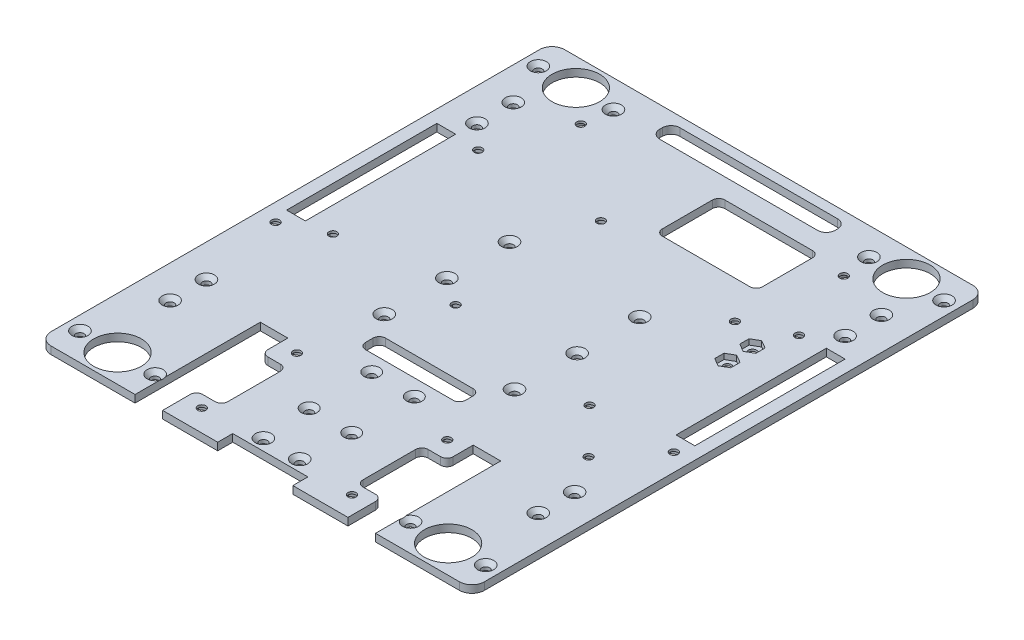
from build123d import *

# Parameters (mm, degrees)
SKETCH1_W           = 173
SKETCH1_H           = 205
BOSS_EXTRUDE1_DEPTH = 3
SKETCH2_R           = 9.5
CUT_EXTRUDE1_DEPTH  = 3
HOLE3_AT_2_COUNT    = 2
HOLE3_AT_2_PITCH    = 30
HOLE3_AT_3_COUNT    = 2
HOLE3_AT_3_PITCH    = 102
HOLE3_AT_4_COUNT    = 2
HOLE3_AT_4_PITCH    = 132
HOLE3_AT_5_COUNT    = 2
HOLE3_AT_5_PITCH    = 225.639092358
HOLE3_AT_6_COUNT    = 2
HOLE3_AT_6_PITCH    = 209.506563143
HOLE3_AT_7_COUNT    = 2
HOLE3_AT_7_PITCH    = 183
HOLE3_AT_8_COUNT    = 2
HOLE3_AT_8_PITCH    = 185.442713526
HOLE1_AT_2_COUNT    = 2
HOLE1_AT_2_PITCH    = 52
HOLE1_AT_3_COUNT    = 2
HOLE1_AT_3_PITCH    = 57.697486947
HOLE1_AT_4_COUNT    = 2
HOLE1_AT_4_PITCH    = 25
HOLE1_AT_5_COUNT    = 2
HOLE1_AT_5_PITCH    = 50
HOLE1_AT_6_COUNT    = 2
HOLE1_AT_6_PITCH    = 72.138755187
SKETCH6_R           = 1.6
CUT_EXTRUDE2_DEPTH  = 2.1
SKETCH6_2_R         = 1.6
SKETCH6_2_W         = 10
SKETCH6_2_H         = 26
CUT_EXTRUDE3_DEPTH  = 269.259203011
HOLE2_AT_2_COUNT    = 2
HOLE2_AT_2_PITCH    = 25
HOLE2_AT_3_COUNT    = 2
HOLE2_AT_3_PITCH    = 30.232432916
HOLE2_AT_4_COUNT    = 2
HOLE2_AT_4_PITCH    = 17
SKETCH20_W          = 20
SKETCH20_H          = 8
CUT_EXTRUDE17_DEPTH = 269.259203011
CUT_EXTRUDE7_DEPTH  = 2.1
HOLE4_D             = 3.2
SKETCH13_4_W        = 40
SKETCH13_4_H        = 25
CUT_EXTRUDE18_DEPTH = 269.259203011
SKETCH19_R          = 1.6
CUT_EXTRUDE15_DEPTH = 2.1
SKETCH19_2_R        = 1.6
CUT_EXTRUDE16_DEPTH = 269.259203011
SKETCH21_W          = 7.5
SKETCH21_H          = 25
CUT_EXTRUDE19_DEPTH = 269.259203011
SKETCH22_3_R        = 1.6
CUT_EXTRUDE21_DEPTH = 269.259203011
SKETCH22_R          = 1.6
CUT_EXTRUDE20_DEPTH = 2.1
HOLE5_AT_2_COUNT    = 2
HOLE5_AT_2_PITCH    = 14.5
HOLE5_AT_3_COUNT    = 2
HOLE5_AT_3_PITCH    = 147.713404943
HOLE5_AT_4_COUNT    = 2
HOLE5_AT_4_PITCH    = 147
HOLE5_AT_5_COUNT    = 2
HOLE5_AT_5_PITCH    = 191.35111706
HOLE5_AT_6_COUNT    = 2
HOLE5_AT_6_PITCH    = 200.942777924
HOLE5_AT_7_COUNT    = 2
HOLE5_AT_7_PITCH    = 137
HOLE5_AT_8_COUNT    = 2
HOLE5_AT_8_PITCH    = 122.5
SKETCH30_W          = 30
SKETCH30_H          = 6
CUT_EXTRUDE27_DEPTH = 269.259203011
HOLE6_AT_2_COUNT    = 2
HOLE6_AT_2_PITCH    = 14.5
SKETCH29_W          = 70
SKETCH29_H          = 8
CUT_EXTRUDE26_DEPTH = 269.259203011
SKETCH33_R          = 1.6
CUT_EXTRUDE28_DEPTH = 2.2
SKETCH33_3_R        = 1.6
CUT_EXTRUDE29_DEPTH = 269.259203011
FILLET1_R           = 5
FILLET2_R           = 2.5
FILLET3_R           = 3.5


with BuildPart() as part:
    # Sketch1 → Boss-Extrude1 (new body)
    with BuildSketch(Plane(origin=(0, 0, 0), x_dir=(1, 0, 0), z_dir=(0, 1, 0))):
        with Locations((-86.5, 102.5)):
            Rectangle(SKETCH1_W, SKETCH1_H)
    extrude(amount=BOSS_EXTRUDE1_DEPTH)

    # Sketch2 → Cut-Extrude1 (cut)
    with BuildSketch(Plane(origin=(0, 3, 0), x_dir=(1, 0, 0), z_dir=(0, 1, 0))):
        with Locations(Location((-152.5, 194, 0), (0, 0, 270))):
            Circle(SKETCH2_R)
        with Locations(Location((-20.5, 194, 0), (0, 0, 270))):
            Circle(SKETCH2_R)
        with Locations(Location((-20.5, 11, 0), (0, 0, 270))):
            Circle(SKETCH2_R)
        with Locations(Location((-152.5, 11, 0), (0, 0, 270))):
            Circle(SKETCH2_R)
    extrude(amount=-CUT_EXTRUDE1_DEPTH, mode=Mode.SUBTRACT)

    # Sketch17 → Hole3 (revolve, cut)
    with BuildSketch(Plane(origin=(-137.5, 3, -11), x_dir=(0, 0, 1), z_dir=(1, 0, 0))):
        Polygon((0, 0), (0, 3), (1.6, 3), (1.6, 1.746093602), (3.2, 0), align=None)
    hole3 = revolve(axis=Axis((-137.5, 9.445314094, -11), (0, -1, 0)), mode=Mode.SUBTRACT)

    # Hole3 at 2: Hole3 ×2
    with Locations(*[(-i * HOLE3_AT_2_PITCH, 0, 0) for i in range(1, HOLE3_AT_2_COUNT)]):
        add(hole3, mode=Mode.SUBTRACT)

    # Hole3 at 3: Hole3 ×2
    with Locations(*[(i * HOLE3_AT_3_PITCH, 0, 0) for i in range(1, HOLE3_AT_3_COUNT)]):
        add(hole3, mode=Mode.SUBTRACT)

    # Hole3 at 4: Hole3 ×2
    with Locations(*[(i * HOLE3_AT_4_PITCH, 0, 0) for i in range(1, HOLE3_AT_4_COUNT)]):
        add(hole3, mode=Mode.SUBTRACT)

    # Hole3 at 5: Hole3 ×2
    with Locations(*[Vector(0.5850050122996966, 0, -0.811029676142761) * (i * HOLE3_AT_5_PITCH) for i in range(1, HOLE3_AT_5_COUNT)]):
        add(hole3, mode=Mode.SUBTRACT)

    # Hole3 at 6: Hole3 ×2
    with Locations(*[Vector(0.48685825622737094, 0, -0.8734809891138121) * (i * HOLE3_AT_6_PITCH) for i in range(1, HOLE3_AT_6_COUNT)]):
        add(hole3, mode=Mode.SUBTRACT)

    # Hole3 at 7: Hole3 ×2
    with Locations(*[(0, 0, -i * HOLE3_AT_7_PITCH) for i in range(1, HOLE3_AT_7_COUNT)]):
        add(hole3, mode=Mode.SUBTRACT)

    # Hole3 at 8: Hole3 ×2
    with Locations(*[Vector(-0.1617750270664808, 0, -0.9868276651055338) * (i * HOLE3_AT_8_PITCH) for i in range(1, HOLE3_AT_8_COUNT)]):
        add(hole3, mode=Mode.SUBTRACT)

    # Sketch4 → Hole1 (revolve, cut)
    with BuildSketch(Plane(origin=(-112.5, 3, -127.5), x_dir=(0, 0, 1), z_dir=(1, 0, 0))):
        Polygon((0, 0), (0, 3), (1.6, 3), (1.6, 1.746093602), (3.2, 0), align=None)
    hole1 = revolve(axis=Axis((-112.5, 9.445314094, -127.5), (0, -1, 0)), mode=Mode.SUBTRACT)

    # Hole1 at 2: Hole1 ×2
    with Locations(*[(i * HOLE1_AT_2_PITCH, 0, 0) for i in range(1, HOLE1_AT_2_COUNT)]):
        add(hole1, mode=Mode.SUBTRACT)

    # Hole1 at 3: Hole1 ×2
    with Locations(*[Vector(0.9012524245251863, 0, 0.43329443486787755) * (i * HOLE1_AT_3_PITCH) for i in range(1, HOLE1_AT_3_COUNT)]):
        add(hole1, mode=Mode.SUBTRACT)

    # Hole1 at 4: Hole1 ×2
    with Locations(*[(0, 0, i * HOLE1_AT_4_PITCH) for i in range(1, HOLE1_AT_4_COUNT)]):
        add(hole1, mode=Mode.SUBTRACT)

    # Hole1 at 5: Hole1 ×2
    with Locations(*[(0, 0, i * HOLE1_AT_5_PITCH) for i in range(1, HOLE1_AT_5_COUNT)]):
        add(hole1, mode=Mode.SUBTRACT)

    # Hole1 at 6: Hole1 ×2
    with Locations(*[Vector(0.7208330649018581, 0, 0.6931087162517825) * (i * HOLE1_AT_6_PITCH) for i in range(1, HOLE1_AT_6_COUNT)]):
        add(hole1, mode=Mode.SUBTRACT)

    # Sketch6 → Cut-Extrude2 (cut)
    # profile 1 of 4: a face of its own
    with BuildSketch(Plane.XZ):
        Polygon((-59.65, -6.818653348), (-59.65, -10.455960044), (-56.5, -12.274613392), (-53.35, -10.455960044), (-53.35, -6.818653348), (-56.5, -5), align=None)
        with Locations(Location((-56.5, -8.637306696, 0), (0, 0, 270))):
            Circle(SKETCH6_R, mode=Mode.SUBTRACT)
    # profile 2 of 4: a face of its own
    with BuildSketch(Plane.XZ):
        Polygon((-59.65, -48.455960044), (-56.5, -50.274613392), (-53.35, -48.455960044), (-53.35, -44.818653348), (-56.5, -43), (-59.65, -44.818653348), align=None)
        with Locations(Location((-56.5, -46.637306696, 0), (0, 0, 270))):
            Circle(SKETCH6_R, mode=Mode.SUBTRACT)
    # profile 3 of 4: a face of its own
    with BuildSketch(Plane.XZ):
        Polygon((-116.5, -12.274613392), (-119.65, -10.455960044), (-119.65, -6.818653348), (-116.5, -5), (-113.35, -6.818653348), (-113.35, -10.455960044), align=None)
        with Locations(Location((-116.5, -8.637306696, 0), (0, 0, 270))):
            Circle(SKETCH6_R, mode=Mode.SUBTRACT)
    # profile 4 of 4: a face of its own
    with BuildSketch(Plane.XZ):
        Polygon((-116.5, -43), (-113.35, -44.818653348), (-113.35, -48.455960044), (-116.5, -50.274613392), (-119.65, -48.455960044), (-119.65, -44.818653348), align=None)
        with Locations(Location((-116.5, -46.637306696, 0), (0, 0, 270))):
            Circle(SKETCH6_R, mode=Mode.SUBTRACT)
    extrude(amount=-CUT_EXTRUDE2_DEPTH, mode=Mode.SUBTRACT)

    # Sketch6<2> → Cut-Extrude3 (cut, through all)
    with BuildSketch(Plane.XZ):
        Polygon((-123.5, -13.5), (-123.5, 0), (-134.5, 0), (-134.5, -50), (-123.5, -50), (-123.5, -39.5), align=None)
        Polygon((-38.5, 0), (-49.5, 0), (-49.5, -13.5), (-49.5, -39.5), (-49.5, -50), (-38.5, -50), align=None)
        with Locations(Location((-116.5, -8.637306696, 0), (0, 0, 270))):
            Circle(SKETCH6_2_R)
        with Locations(Location((-116.5, -46.637306696, 0), (0, 0, 270))):
            Circle(SKETCH6_2_R)
        with Locations(Location((-56.5, -46.637306696, 0), (0, 0, 270))):
            Circle(SKETCH6_2_R)
        with Locations(Location((-56.5, -8.637306696, 0), (0, 0, 270))):
            Circle(SKETCH6_2_R)
        with Locations((-118.5, -26.5)):
            Rectangle(SKETCH6_2_W, SKETCH6_2_H)
        with Locations((-54.5, -26.5)):
            Rectangle(SKETCH6_2_W, SKETCH6_2_H)
    extrude(amount=-CUT_EXTRUDE3_DEPTH, mode=Mode.SUBTRACT)

    # Sketch10 → Hole2 (revolve, cut)
    with BuildSketch(Plane(origin=(-95, 3, -55), x_dir=(0, 0, 1), z_dir=(1, 0, 0))):
        Polygon((0, 0), (0, 3), (1.6, 3), (1.6, 1.636962752), (3.1, 0), align=None)
    hole2 = revolve(axis=Axis((-95, 9.445314094, -55), (0, -1, 0)), mode=Mode.SUBTRACT)

    # Hole2 at 2: Hole2 ×2
    with Locations(*[(0, 0, i * HOLE2_AT_2_PITCH) for i in range(1, HOLE2_AT_2_COUNT)]):
        add(hole2, mode=Mode.SUBTRACT)

    # Hole2 at 3: Hole2 ×2
    with Locations(*[Vector(0.5623100214072783, 0, 0.8269265020695288) * (i * HOLE2_AT_3_PITCH) for i in range(1, HOLE2_AT_3_COUNT)]):
        add(hole2, mode=Mode.SUBTRACT)

    # Hole2 at 4: Hole2 ×2
    with Locations(*[(i * HOLE2_AT_4_PITCH, 0, 0) for i in range(1, HOLE2_AT_4_COUNT)]):
        add(hole2, mode=Mode.SUBTRACT)

    # Sketch20 → Cut-Extrude17 (cut, through all)
    with BuildSketch(Plane(origin=(0, 3, 0), x_dir=(1, 0, 0), z_dir=(0, 1, 0))):
        with Locations((-76.5, 65.5)):
            Rectangle(SKETCH20_W, SKETCH20_H)
        with Locations((-96.5, 65.5)):
            Rectangle(SKETCH20_W, SKETCH20_H)
    extrude(amount=-CUT_EXTRUDE17_DEPTH, mode=Mode.SUBTRACT)

    # Sketch13 → Cut-Extrude7 (cut)
    with BuildSketch(Plane.XZ):
        Polygon((-19.3, -70.789785834), (-19.3, -67.210214166), (-22.4, -65.420428331), (-25.5, -67.210214166), (-25.5, -70.789785834), (-22.4, -72.579571669), align=None)
        Polygon((-147.7, -93.383419246), (-150.5, -91.766838493), (-153.3, -93.383419246), (-153.3, -96.616580754), (-150.5, -98.233161507), (-147.7, -96.616580754), align=None)
        Polygon((-98.7, -96.616580754), (-98.7, -93.383419246), (-101.5, -91.766838493), (-104.3, -93.383419246), (-104.3, -96.616580754), (-101.5, -98.233161507), align=None)
        Polygon((-147.7, -154.616580754), (-147.7, -151.383419246), (-150.5, -149.766838493), (-153.3, -151.383419246), (-153.3, -154.616580754), (-150.5, -156.233161507), align=None)
        Polygon((-98.7, -151.383419246), (-101.5, -149.766838493), (-104.3, -151.383419246), (-104.3, -154.616580754), (-101.5, -156.233161507), (-98.7, -154.616580754), align=None)
        Polygon((-22.4, -149.420428331), (-25.5, -151.210214166), (-25.5, -154.789785834), (-22.4, -156.579571669), (-19.3, -154.789785834), (-19.3, -151.210214166), align=None)
    extrude(amount=-CUT_EXTRUDE7_DEPTH, mode=Mode.SUBTRACT)

    # Hole4 (through all)
    with Locations(Plane(origin=(-150.5, 0, -95), x_dir=(0, 0, -1), z_dir=(0, -1, 0))):
        with Locations((0, 0), (0, 49), (58, 49), (58, 0), (58, 128.1), (-26, 128.1)):
            Hole(HOLE4_D / 2)

    # Sketch13<4> → Cut-Extrude18 (cut, through all)
    with BuildSketch(Plane.XZ):
        with Locations((-66.5, -172.5)):
            Rectangle(SKETCH13_4_W, SKETCH13_4_H)
    extrude(amount=-CUT_EXTRUDE18_DEPTH, mode=Mode.SUBTRACT)

    # Sketch19 → Cut-Extrude15 (cut)
    # profile 1 of 4: a face of its own
    with BuildSketch(Plane(origin=(0, 0, 0), x_dir=(1, 0, 0), z_dir=(0, 1, 0))):
        Polygon((-135.304958277, 182.5), (-137.152479139, 185.7), (-140.847520861, 185.7), (-142.695041723, 182.5), (-140.847520861, 179.3), (-137.152479139, 179.3), align=None)
        with Locations(Location((-139, 182.5, 0), (0, 0, 270))):
            Circle(SKETCH19_R, mode=Mode.SUBTRACT)
    # profile 2 of 4: a face of its own
    with BuildSketch(Plane(origin=(0, 0, 0), x_dir=(1, 0, 0), z_dir=(0, 1, 0))):
        Polygon((-32.152479139, 179.3), (-30.304958277, 182.5), (-32.152479139, 185.7), (-35.847520861, 185.7), (-37.695041723, 182.5), (-35.847520861, 179.3), align=None)
        with Locations(Location((-34, 182.5, 0), (0, 0, 270))):
            Circle(SKETCH19_R, mode=Mode.SUBTRACT)
    # profile 3 of 4: a face of its own
    with BuildSketch(Plane(origin=(0, 0, 0), x_dir=(1, 0, 0), z_dir=(0, 1, 0))):
        Polygon((-166, 91.305041723), (-169.2, 89.457520861), (-169.2, 85.762479139), (-166, 83.914958277), (-162.8, 85.762479139), (-162.8, 89.457520861), align=None)
        with Locations(Location((-166, 87.61, 0), (0, 0, 270))):
            Circle(SKETCH19_R, mode=Mode.SUBTRACT)
    # profile 4 of 4: a face of its own
    with BuildSketch(Plane(origin=(0, 0, 0), x_dir=(1, 0, 0), z_dir=(0, 1, 0))):
        Polygon((-10.2, 89.457520861), (-7, 91.305041723), (-3.8, 89.457520861), (-3.8, 85.762479139), (-7, 83.914958277), (-10.2, 85.762479139), align=None)
        with Locations(Location((-7, 87.61, 0), (0, 0, 90))):
            Circle(SKETCH19_R, mode=Mode.SUBTRACT)
    extrude(amount=CUT_EXTRUDE15_DEPTH, mode=Mode.SUBTRACT)

    # Sketch19<2> → Cut-Extrude16 (cut, through all)
    with BuildSketch(Plane(origin=(0, 0, 0), x_dir=(1, 0, 0), z_dir=(0, 1, 0))):
        with Locations(Location((-34, 182.5, 0), (0, 0, 270))):
            Circle(SKETCH19_2_R)
        with Locations(Location((-139, 182.5, 0), (0, 0, 270))):
            Circle(SKETCH19_2_R)
        with Locations(Location((-166, 87.61, 0), (0, 0, 270))):
            Circle(SKETCH19_2_R)
        with Locations(Location((-7, 87.61, 0), (0, 0, 90))):
            Circle(SKETCH19_2_R)
    extrude(amount=CUT_EXTRUDE16_DEPTH, mode=Mode.SUBTRACT)

    # Sketch21 → Cut-Extrude19 (cut, through all)
    with BuildSketch(Plane(origin=(0, 3, 0), x_dir=(1, 0, 0), z_dir=(0, 1, 0))):
        with Locations((-8.75, 141.5)):
            Rectangle(SKETCH21_W, SKETCH21_H)
        with Locations((-8.75, 106.5)):
            Rectangle(SKETCH21_W, SKETCH21_H)
        with Locations((-164.25, 141.5)):
            Rectangle(SKETCH21_W, SKETCH21_H)
        with Locations((-164.25, 106.5)):
            Rectangle(SKETCH21_W, SKETCH21_H)
        Polygon((-12.5, 119), (-5, 119), (-5, 129), (-12.5, 129), (-12.5, 124), align=None)
        Polygon((-168, 119), (-160.5, 119), (-160.5, 124), (-160.5, 129), (-168, 129), align=None)
    extrude(amount=-CUT_EXTRUDE19_DEPTH, mode=Mode.SUBTRACT)

    # Sketch22<3> → Cut-Extrude21 (cut, through all)
    with BuildSketch(Plane.XZ):
        with Locations(Location((-40, -87, 0), (0, 0, 270))):
            Circle(SKETCH22_3_R)
        with Locations(Location((-40, -145, 0), (0, 0, 270))):
            Circle(SKETCH22_3_R)
    extrude(amount=-CUT_EXTRUDE21_DEPTH, mode=Mode.SUBTRACT)

    # Sketch22 → Cut-Extrude20 (cut)
    # profile 1 of 2: a face of its own
    with BuildSketch(Plane.XZ):
        Polygon((-43.2, -88.847520861), (-40, -90.695041723), (-36.8, -88.847520861), (-36.8, -85.152479139), (-40, -83.304958277), (-43.2, -85.152479139), align=None)
        with Locations(Location((-40, -87, 0), (0, 0, 270))):
            Circle(SKETCH22_R, mode=Mode.SUBTRACT)
    # profile 2 of 2: a face of its own
    with BuildSketch(Plane.XZ):
        Polygon((-43.2, -146.847520861), (-40, -148.695041723), (-36.8, -146.847520861), (-36.8, -143.152479139), (-40, -141.304958277), (-43.2, -143.152479139), align=None)
        with Locations(Location((-40, -145, 0), (0, 0, 270))):
            Circle(SKETCH22_R, mode=Mode.SUBTRACT)
    extrude(amount=-CUT_EXTRUDE20_DEPTH, mode=Mode.SUBTRACT)

    # Sketch27 → Hole5 (revolve, cut)
    with BuildSketch(Plane(origin=(-160, 3, -176.5), x_dir=(0, 0, 1), z_dir=(1, 0, 0))):
        Polygon((0, 0), (0, 3), (1.6, 3), (1.6, 1.6), (3.2, 0), align=None)
    hole5 = revolve(axis=Axis((-160, 9.445314094, -176.5), (0, -1, 0)), mode=Mode.SUBTRACT)

    # Hole5 at 2: Hole5 ×2
    with Locations(*[(0, 0, i * HOLE5_AT_2_PITCH) for i in range(1, HOLE5_AT_2_COUNT)]):
        add(hole5, mode=Mode.SUBTRACT)

    # Hole5 at 3: Hole5 ×2
    with Locations(*[Vector(0.995170343925355, 0, 0.09816306113549421) * (i * HOLE5_AT_3_PITCH) for i in range(1, HOLE5_AT_3_COUNT)]):
        add(hole5, mode=Mode.SUBTRACT)

    # Hole5 at 4: Hole5 ×2
    with Locations(*[(i * HOLE5_AT_4_PITCH, 0, 0) for i in range(1, HOLE5_AT_4_COUNT)]):
        add(hole5, mode=Mode.SUBTRACT)

    # Hole5 at 5: Hole5 ×2
    with Locations(*[Vector(0.7682212795973757, 0, 0.6401843996644799) * (i * HOLE5_AT_5_PITCH) for i in range(1, HOLE5_AT_5_COUNT)]):
        add(hole5, mode=Mode.SUBTRACT)

    # Hole5 at 6: Hole5 ×2
    with Locations(*[Vector(0.7315515467555609, 0, 0.6817861354116453) * (i * HOLE5_AT_6_PITCH) for i in range(1, HOLE5_AT_6_COUNT)]):
        add(hole5, mode=Mode.SUBTRACT)

    # Hole5 at 7: Hole5 ×2
    with Locations(*[(0, 0, i * HOLE5_AT_7_PITCH) for i in range(1, HOLE5_AT_7_COUNT)]):
        add(hole5, mode=Mode.SUBTRACT)

    # Hole5 at 8: Hole5 ×2
    with Locations(*[(0, 0, i * HOLE5_AT_8_PITCH) for i in range(1, HOLE5_AT_8_COUNT)]):
        add(hole5, mode=Mode.SUBTRACT)

    # Sketch30 → Cut-Extrude27 (cut, through all)
    with BuildSketch(Plane(origin=(0, 3, 0), x_dir=(1, 0, 0), z_dir=(0, 1, 0))):
        with Locations((-86.5, 3)):
            Rectangle(SKETCH30_W, SKETCH30_H)
    extrude(amount=-CUT_EXTRUDE27_DEPTH, mode=Mode.SUBTRACT)

    # Sketch32 → Hole6 (revolve, cut)
    with BuildSketch(Plane(origin=(-79.25, 3, -10.5), x_dir=(0, 0, 1), z_dir=(1, 0, 0))):
        Polygon((0, 0), (0, 3), (1.6, 3), (1.6, 1.6), (3.2, 0), align=None)
    hole6 = revolve(axis=Axis((-79.25, 9.445314094, -10.5), (0, -1, 0)), mode=Mode.SUBTRACT)

    # Hole6 at 2: Hole6 ×2
    with Locations(*[(-i * HOLE6_AT_2_PITCH, 0, 0) for i in range(1, HOLE6_AT_2_COUNT)]):
        add(hole6, mode=Mode.SUBTRACT)

    # Sketch29 → Cut-Extrude26 (cut, through all)
    with BuildSketch(Plane(origin=(0, 3, 0), x_dir=(1, 0, 0), z_dir=(0, 1, 0))):
        with Locations((-86.5, 197)):
            Rectangle(SKETCH29_W, SKETCH29_H)
    extrude(amount=-CUT_EXTRUDE26_DEPTH, mode=Mode.SUBTRACT)

    # Sketch33 → Cut-Extrude28 (cut)
    # profile 1 of 2: a face of its own
    with BuildSketch(Plane(origin=(0, 3, 0), x_dir=(1, 0, 0), z_dir=(0, 1, 0))):
        Polygon((-31.2, 128.152479139), (-28, 126.304958277), (-24.8, 128.152479139), (-24.8, 131.847520861), (-28, 133.695041723), (-31.2, 131.847520861), align=None)
        with Locations(Location((-28, 130, 0), (0, 0, 270))):
            Circle(SKETCH33_R, mode=Mode.SUBTRACT)
    # profile 2 of 2: a face of its own
    with BuildSketch(Plane(origin=(0, 3, 0), x_dir=(1, 0, 0), z_dir=(0, 1, 0))):
        Polygon((-31.2, 138.152479139), (-28, 136.304958277), (-24.8, 138.152479139), (-24.8, 141.847520861), (-28, 143.695041723), (-31.2, 141.847520861), align=None)
        with Locations(Location((-28, 140, 0), (0, 0, 270))):
            Circle(SKETCH33_R, mode=Mode.SUBTRACT)
    extrude(amount=-CUT_EXTRUDE28_DEPTH, mode=Mode.SUBTRACT)

    # Sketch33<3> → Cut-Extrude29 (cut, through all)
    with BuildSketch(Plane(origin=(0, 3, 0), x_dir=(1, 0, 0), z_dir=(0, 1, 0))):
        with Locations(Location((-28, 130, 0), (0, 0, 270))):
            Circle(SKETCH33_3_R)
        with Locations(Location((-28, 140, 0), (0, 0, 270))):
            Circle(SKETCH33_3_R)
    extrude(amount=-CUT_EXTRUDE29_DEPTH, mode=Mode.SUBTRACT)

    # Fillet1
    fillet1_edges = [part.edges().sort_by_distance(p)[0] for p in [
        (0, 1.5, 0),
        (-173, 1.5, 0),
        (-173, 1.5, -205),
        (0, 1.5, -205),
    ]]
    fillet(fillet1_edges, radius=FILLET1_R)

    # Fillet2
    fillet2_edges = [part.edges().sort_by_distance(p)[0] for p in [
        (-123.5, 1.5, -13.5),
        (-113.5, 1.5, -13.5),
        (-113.5, 1.5, -39.5),
        (-123.5, 1.5, -39.5),
        (-49.5, 1.5, -39.5),
        (-59.5, 1.5, -39.5),
        (-59.5, 1.5, -13.5),
        (-49.5, 1.5, -13.5),
        (-106.5, 1.5, -69.5),
        (-66.5, 1.5, -69.5),
        (-66.5, 1.5, -61.5),
        (-106.5, 1.5, -61.5),
        (-86.5, 1.5, -160),
        (-46.5, 1.5, -160),
        (-46.5, 1.5, -185),
        (-86.5, 1.5, -185),
    ]]
    fillet(fillet2_edges, radius=FILLET2_R)

    # Fillet3
    fillet3_edges = [part.edges().sort_by_distance(p)[0] for p in [
        (-121.5, 1.5, -193),
        (-121.5, 1.5, -201),
        (-51.5, 1.5, -201),
        (-51.5, 1.5, -193),
    ]]
    fillet(fillet3_edges, radius=FILLET3_R)


solid = part.part
